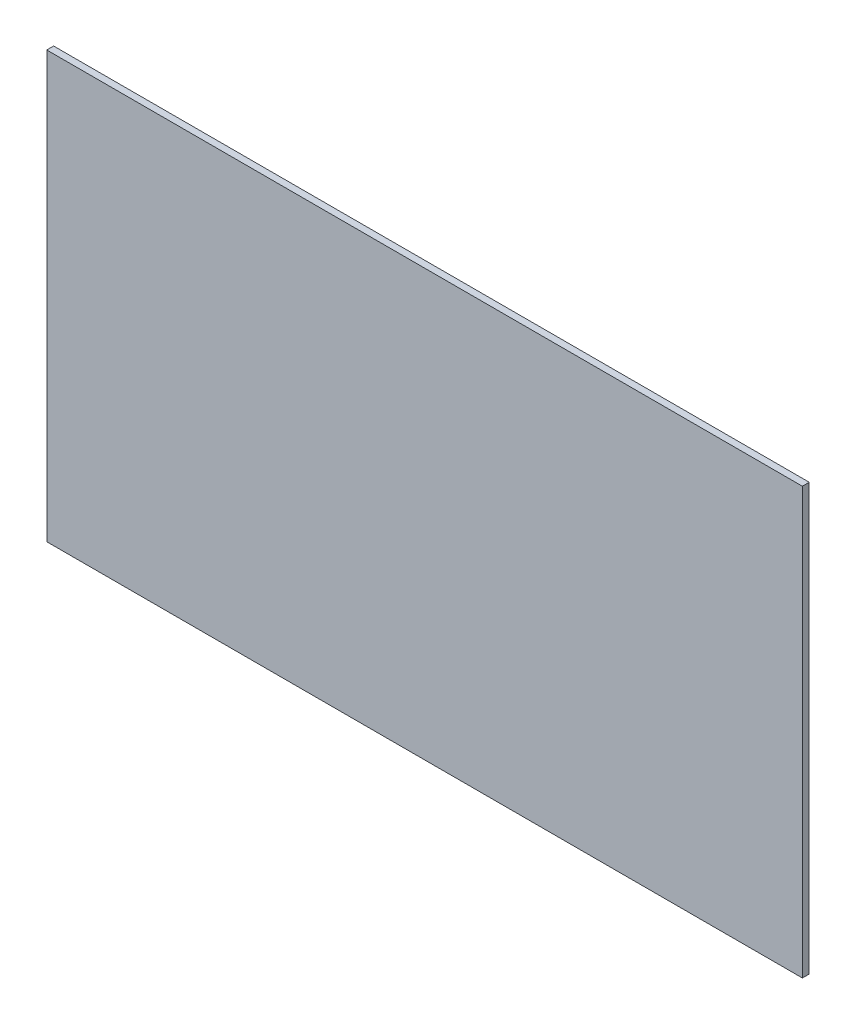
from build123d import *

# Parameters (mm, degrees)
SKETCH1_W           = 13.97
SKETCH1_H           = 7.874
BOSS_EXTRUDE1_DEPTH = 0.127
WRAP2_START         = -0.0254
WRAP2_DEPTH         = 0.0254


# Read off the part's stored shape, not the designer's step: Wrap2
with BuildPart() as part:
    # Sketch1 → Boss-Extrude1 (new body)
    with BuildSketch(Plane.XY):
        with Locations((-7.432564008, -85.108134992)):
            Rectangle(SKETCH1_W, SKETCH1_H)
    extrude(amount=BOSS_EXTRUDE1_DEPTH)

    # Wrap2 outline → Wrap2 (cut)
    # profile 1 of 3: a face of its own
    with BuildSketch(Plane(origin=(0, 0, 0), x_dir=(-1, 0, 0), z_dir=(0, 0, -1)).offset(WRAP2_START)):
        with BuildLine():
            add(Edge.make_bspline(
                [(3.826469564, -84.963158025), (3.827010027, -84.917677488), (3.828104792, -84.825552), (3.836108508, -84.685484109), (3.850519029, -84.542286335), (3.867873709, -84.396902881), (3.893643168, -84.253181502), (3.929096048, -84.114035219), (3.974808247, -83.981817181), (4.028342433, -83.855668459), (4.093310971, -83.738030743), (4.170886206, -83.63021293), (4.261303249, -83.533608273), (4.345926352, -83.46180179), (4.419782346, -83.410748531), (4.480095673, -83.377701727), (4.544461085, -83.350231984), (4.612521738, -83.326528765), (4.68521128, -83.310415652), (4.76135621, -83.29638795), (4.841881411, -83.289666964), (4.896910681, -83.288536329), (4.925036713, -83.287958449)],
                knots=[0, 0, 0, 0, 0.060393733, 0.122333696, 0.186219252, 0.251490299, 0.316717007, 0.37996741, 0.441958181, 0.502323024, 0.561736642, 0.620028303, 0.678231582, 0.737019629, 0.767036674, 0.797324631, 0.82815831, 0.859890953, 0.892862392, 0.926911734, 0.962643827, 1, 1, 1, 1], degree=3))
            Line((3.826469564, -84.963158025), (3.826469564, -85.228079437))
            Line((3.826469564, -85.228079437), (4.934262831, -85.228079437))
            Line((4.934262831, -85.228079437), (4.934262831, -84.595431289))
            Line((4.934262831, -84.595431289), (4.501294255, -84.595431289))
            add(Edge.make_bspline(
                [(4.903289433, -83.920606597), (4.883020015, -83.921518297), (4.843781227, -83.923283222), (4.787539956, -83.936120227), (4.737731616, -83.960032853), (4.694035563, -83.991873703), (4.65677765, -84.030716275), (4.623681087, -84.073267778), (4.594108521, -84.119444237), (4.563257184, -84.187706346), (4.533369818, -84.278281117), (4.51402702, -84.389637441), (4.503598137, -84.495710962), (4.502025527, -84.563779213), (4.501294255, -84.595431289)],
                knots=[0, 0, 0, 0, 0.069384746, 0.134319266, 0.195878399, 0.257248919, 0.318402508, 0.379477442, 0.441653576, 0.505574289, 0.6354172, 0.766982137, 0.891645533, 1, 1, 1, 1], degree=3))
            add(Edge.make_bspline(
                [(5.429178206, -85.059373264), (5.429024369, -85.03608762), (5.428699232, -84.986872999), (5.426790574, -84.909085734), (5.422505919, -84.823427687), (5.417557397, -84.731338954), (5.410538619, -84.635978716), (5.397054266, -84.540994333), (5.379156301, -84.447765598), (5.357372325, -84.356826658), (5.32958417, -84.26947942), (5.293509852, -84.188591179), (5.24988398, -84.114578629), (5.201121993, -84.047039536), (5.142120957, -83.990169438), (5.071724956, -83.948809925), (4.990496804, -83.9246758), (4.933110214, -83.921998071), (4.903289433, -83.920606597)],
                knots=[0, 0, 0, 0, 0.050260659, 0.106226792, 0.167930094, 0.235364177, 0.305294022, 0.374224991, 0.442292833, 0.510140692, 0.575963688, 0.639847254, 0.700835971, 0.761146376, 0.819171409, 0.876337748, 0.935739257, 1, 1, 1, 1], degree=3))
            add(Edge.make_bspline(
                [(4.923718696, -86.198139931), (4.941978047, -86.197983673), (4.977659622, -86.197678321), (5.029590573, -86.188774852), (5.077051545, -86.170390041), (5.120666255, -86.144993152), (5.159731256, -86.112253488), (5.196358978, -86.074948111), (5.230215367, -86.032855586), (5.269845718, -85.967732887), (5.313768574, -85.877005825), (5.351216379, -85.757043204), (5.381026394, -85.631798202), (5.402269582, -85.505075767), (5.417756569, -85.381079587), (5.425040742, -85.262874233), (5.428004678, -85.156264467), (5.428811028, -85.089688945), (5.429178206, -85.059373264)],
                knots=[0, 0, 0, 0, 0.039954261, 0.078076757, 0.114618514, 0.150839038, 0.188105085, 0.225864661, 0.265232508, 0.306077519, 0.392572504, 0.485217949, 0.580663708, 0.674382043, 0.766451173, 0.854194653, 0.933606403, 1, 1, 1, 1], degree=3))
            add(Edge.make_bspline(
                [(4.57773924, -85.755945235), (4.582577242, -85.778348376), (4.592791408, -85.825646697), (4.608395816, -85.89847248), (4.631209267, -85.972009886), (4.663647447, -86.041845309), (4.70942621, -86.102520974), (4.754973641, -86.147029353), (4.799200923, -86.173778979), (4.837098167, -86.188186847), (4.879168417, -86.196926256), (4.908517542, -86.197725809), (4.923718696, -86.198139931)],
                knots=[0, 0, 0, 0, 0.111459761, 0.235317872, 0.361999582, 0.485262074, 0.607464743, 0.729909934, 0.79219494, 0.857458843, 0.926171904, 1, 1, 1, 1], degree=3))
            Line((4.57773924, -85.755945235), (3.916753726, -86.01098152))
            add(Edge.make_bspline(
                [(4.928331755, -86.830788079), (4.896434292, -86.830332212), (4.833749721, -86.829436348), (4.742047146, -86.817132973), (4.654126811, -86.801194053), (4.571134339, -86.775092112), (4.491560198, -86.74425801), (4.417258458, -86.703781354), (4.345830532, -86.658720769), (4.280219139, -86.604886836), (4.219315678, -86.545306137), (4.161721217, -86.482381172), (4.109294678, -86.414342392), (4.061486444, -86.342341386), (4.018231492, -86.265633071), (3.979613777, -86.18479514), (3.945045633, -86.099679103), (3.926255949, -86.040771812), (3.916753726, -86.01098152)],
                knots=[0, 0, 0, 0, 0.06797528, 0.133584331, 0.197076538, 0.25828747, 0.318840405, 0.378783068, 0.438433894, 0.49872708, 0.559361524, 0.620061096, 0.680506997, 0.742360057, 0.804250369, 0.868164685, 0.933328923, 1, 1, 1, 1], degree=3))
            add(Edge.make_bspline(
                [(6.14617944, -85.040921026), (6.145521872, -85.090800393), (6.144196793, -85.191313407), (6.134042597, -85.34350023), (6.11665869, -85.498005886), (6.093538793, -85.653878197), (6.062363872, -85.807745753), (6.018887243, -85.956012754), (5.966707906, -86.098134931), (5.90283112, -86.232639552), (5.828171088, -86.358305611), (5.740679889, -86.472773753), (5.640121565, -86.574558841), (5.54767066, -86.650447491), (5.467099706, -86.703334293), (5.402229448, -86.738037504), (5.332739537, -86.765751972), (5.259832099, -86.790003038), (5.182616631, -86.808196765), (5.101355264, -86.821285924), (5.016142878, -86.829352977), (4.958005093, -86.830303126), (4.928331755, -86.830788079)],
                knots=[0, 0, 0, 0, 0.061459125, 0.123847641, 0.187845431, 0.252999934, 0.317977647, 0.381110967, 0.443205197, 0.50434819, 0.564324292, 0.62301118, 0.681390769, 0.740278313, 0.77000872, 0.800038277, 0.830750549, 0.862079276, 0.894643031, 0.928373853, 0.963442246, 1, 1, 1, 1], degree=3))
            add(Edge.make_bspline(
                [(4.925036713, -83.287958449), (4.962652324, -83.288728972), (5.035765254, -83.290226625), (5.142181401, -83.305182693), (5.242179768, -83.329163602), (5.335515369, -83.363965041), (5.422760168, -83.406508535), (5.505044685, -83.455300925), (5.581568633, -83.511420955), (5.652295495, -83.574395033), (5.717470366, -83.643361149), (5.778256244, -83.716667025), (5.832585948, -83.796167108), (5.881609023, -83.880006865), (5.92560631, -83.968130055), (5.96591433, -84.058848519), (6.001368692, -84.152702414), (6.043531579, -84.281209473), (6.08653268, -84.445801174), (6.120163208, -84.646159486), (6.142505611, -84.844689175), (6.14496925, -84.976280597), (6.14617944, -85.040921026)],
                knots=[0, 0, 0, 0, 0.047256178, 0.091851162, 0.134778824, 0.176275084, 0.216781148, 0.256653584, 0.296362193, 0.335871578, 0.375518698, 0.415540005, 0.455443979, 0.496407668, 0.537528331, 0.579189623, 0.621138159, 0.663574591, 0.749164871, 0.834643731, 0.918773579, 1, 1, 1, 1], degree=3))
        make_face()
    # profile 2 of 3: a face of its own
    with BuildSketch(Plane(origin=(0, 0, 0), x_dir=(-1, 0, 0), z_dir=(0, 0, -1)).offset(WRAP2_START)):
        Polygon((6.829571242, -86.999494252), (8.620097303, -82.567662172), (8.100798615, -82.567662172), (6.310272554, -86.999494252), align=None)
    # profile 3 of 3: a face of its own
    with BuildSketch(Plane(origin=(0, 0, 0), x_dir=(-1, 0, 0), z_dir=(0, 0, -1)).offset(WRAP2_START)):
        Polygon((9.643537484, -83.920606597), (9.516348846, -83.330134992), (8.792098518, -83.330134992), (9.616518136, -86.746434992), (10.331542345, -86.746434992), (11.128942615, -83.330134992), (10.454776933, -83.330134992), (10.331542345, -83.920606597), align=None)
        Polygon((10.076506061, -85.361199151), (10.003356118, -85.86731767), (9.994789008, -85.86731767), (9.917026007, -85.361199151), (9.743706774, -84.468901659), (10.222146936, -84.468901659), align=None, mode=Mode.SUBTRACT)
    extrude(amount=WRAP2_DEPTH, mode=Mode.SUBTRACT)


solid = part.part
